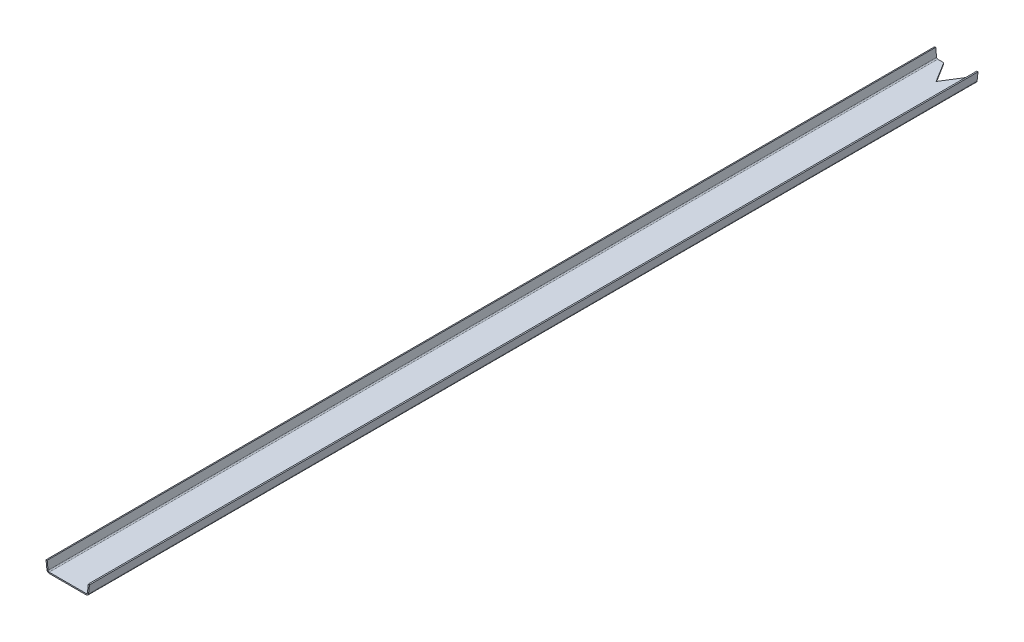
from build123d import *

# Parameters (mm, degrees)
TABAN_FLAN_1_DEPTH         = 5990
KES_EKSTR_ZYON1_DEPTH      = 5998.486934273
KES_EKSTR_ZYON1_DEPTH_BACK = 5998.486934273


# Sheet-metal steps are written as plain solids
with BuildPart() as part:
    # Çizim1 → Taban-Flanş1 (new body)
    with BuildSketch(Plane.XY):
        with BuildLine():
            Line((0, 0), (5.960525983, -55.31134025))
            ThreePointArc((5.960525983, -55.31134025), (11.177974486, -65.501435482), (21.868424162, -69.597054535))
            Line((21.868424162, -69.597054535), (271.131575838, -69.597054535))
            ThreePointArc((271.131575838, -69.597054535), (281.822025514, -65.501435482), (287.039474017, -55.31134025))
            Line((287.039474017, -55.31134025), (293, 0))
            Line((293, 0), (285.04605091, 0.857142857))
            Line((285.04605091, 0.857142857), (279.085524928, -54.454197393))
            ThreePointArc((279.085524928, -54.454197393), (276.476800676, -59.549245009), (271.131575838, -61.597054535))
            Line((271.131575838, -61.597054535), (21.868424162, -61.597054535))
            ThreePointArc((21.868424162, -61.597054535), (16.523199324, -59.549245009), (13.914475072, -54.454197393))
            Line((13.914475072, -54.454197393), (7.95394909, 0.857142857))
            Line((7.95394909, 0.857142857), (0, 0))
        make_face()
    extrude(amount=TABAN_FLAN_1_DEPTH)

    # Çizim6 → Kes-Ekstrüzyon1 (cut, two sides: drawn at the far end of the back side and taken through both)
    with BuildSketch(Plane(origin=(0, -61.597054535, 0), x_dir=(1, 0, 0), z_dir=(0, 1, 0)).offset(-KES_EKSTR_ZYON1_DEPTH_BACK)):
        Polygon((62, 0), (146.5, -135.866662578), (231, 0), (231, 53.477890067), (62, 53.477890067), align=None)
    extrude(amount=KES_EKSTR_ZYON1_DEPTH + KES_EKSTR_ZYON1_DEPTH_BACK, mode=Mode.SUBTRACT)


solid = part.part
